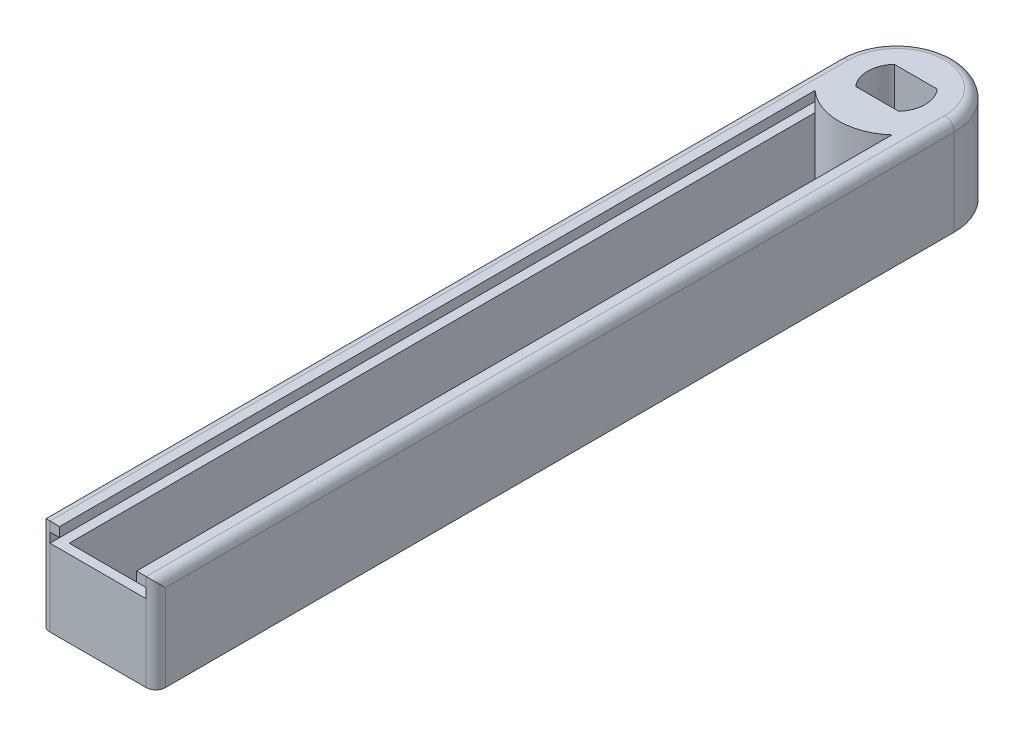
from build123d import *
from build123d.topology import SkipClean

# Parameters (mm, degrees)
SKETCH1_W           = 1
SKETCH1_H           = 1
SKETCH1_W_2         = 5
BOSS_EXTRUDE2_DEPTH = 10
CUT_EXTRUDE1_DEPTH  = 7.5
CUT_EXTRUDE2_START  = -2.5
CUT_EXTRUDE2_DEPTH  = 2.5
CUT_EXTRUDE3_REACH  = 92.05
SKETCH5_W           = 5
SKETCH5_H           = 1
SKETCH6_W           = 2
SKETCH6_H           = 1
BOSS_EXTRUDE3_DEPTH = 79.5
FILLET1_R           = 1
SKETCH7_W           = 1
SKETCH7_H           = 1
CUT_EXTRUDE7_DEPTH  = 79
BOSS_EXTRUDE4_DEPTH = 3
SKETCH9_W           = 1
SKETCH9_H           = 1
CUT_EXTRUDE8_DEPTH  = 6
SKETCH11_W          = 1
SKETCH11_H          = 1
BOSS_EXTRUDE5_DEPTH = 80
SKETCH12_W          = 1
SKETCH12_H          = 1
BOSS_EXTRUDE6_DEPTH = 80
BOSS_EXTRUDE7_DEPTH = 8
CUT_EXTRUDE9_DEPTH  = 1
SKETCH15_R          = 3
CUT_EXTRUDE10_DEPTH = 2.5
CUT_EXTRUDE13_REACH = 79.281


with BuildPart() as part:
    # Sketch1 → Boss-Extrude2 (new body)
    with BuildSketch(Plane(origin=(0, 0, 0), x_dir=(1, 0, 0), z_dir=(0, 1, 0))):
        with BuildLine():
            Line((-5.881818182, 6.945454545), (-3.381818182, 6.945454545))
            Line((-3.381818182, 6.945454545), (-0.881818182, 6.945454545))
            ThreePointArc((-0.881818182, 6.945454545), (-3.381818182, 9.445454545), (-5.881818182, 6.945454545))
        make_face()
        with BuildLine():
            Line((-0.881818182, 6.945454545), (-3.381818182, 6.945454545))
            Line((-3.381818182, 6.945454545), (-3.381818182, 4.445454545))
            ThreePointArc((-3.381818182, 4.445454545), (-1.614051229, 5.177687592), (-0.881818182, 6.945454545))
        make_face()
        with BuildLine():
            Line((-3.381818182, 4.445454545), (-3.381818182, 6.945454545))
            Line((-3.381818182, 6.945454545), (-5.881818182, 6.945454545))
            ThreePointArc((-5.881818182, 6.945454545), (-5.149585135, 5.177687592), (-3.381818182, 4.445454545))
        make_face()
        with BuildLine():
            ThreePointArc((-0.881818182, 6.945454545), (-1.614051229, 5.177687592), (-3.381818182, 4.445454545))
            Line((-3.381818182, 4.445454545), (-3.381818182, 0.945454545))
            ThreePointArc((-3.381818182, 0.945454545), (-0.544543851, 1.658690472), (1.618181818, 3.628829755))
            ThreePointArc((1.618181818, 3.628829755), (2.362744465, 5.213403738), (2.618181818, 6.945454545))
            Line((2.618181818, 6.945454545), (-0.881818182, 6.945454545))
        make_face()
        with BuildLine():
            Line((-3.381818182, 0.945454545), (-3.381818182, 4.445454545))
            ThreePointArc((-3.381818182, 4.445454545), (-5.149585135, 5.177687592), (-5.881818182, 6.945454545))
            Line((-5.881818182, 6.945454545), (-9.381818182, 6.945454545))
            ThreePointArc((-9.381818182, 6.945454545), (-9.126380828, 5.213403738), (-8.381818182, 3.628829755))
            ThreePointArc((-8.381818182, 3.628829755), (-6.219092513, 1.658690472), (-3.381818182, 0.945454545))
        make_face()
        with BuildLine():
            ThreePointArc((-5.881818182, 6.945454545), (-3.381818182, 9.445454545), (-0.881818182, 6.945454545))
            Line((-0.881818182, 6.945454545), (2.618181818, 6.945454545))
            ThreePointArc((2.618181818, 6.945454545), (-3.381818182, 12.945454545), (-9.381818182, 6.945454545))
            Line((-9.381818182, 6.945454545), (-5.881818182, 6.945454545))
        make_face()
        with BuildLine():
            Line((2.618181818, -75.054545455), (2.618181818, 6.945454545))
            ThreePointArc((2.618181818, 6.945454545), (2.362744465, 5.213403738), (1.618181818, 3.628829755))
            Line((1.618181818, 3.628829755), (1.618181818, -75.054545455))
            Line((1.618181818, -75.054545455), (2.618181818, -75.054545455))
        make_face()
        with BuildLine():
            ThreePointArc((-8.381818182, 3.628829755), (-9.126380828, 5.213403738), (-9.381818182, 6.945454545))
            Line((-9.381818182, 6.945454545), (-9.381818182, -75.054545455))
            Line((-9.381818182, -75.054545455), (-8.381818182, -75.054545455))
            Line((-8.381818182, -75.054545455), (-8.381818182, 3.628829755))
        make_face()
        with Locations((-8.881818182, -75.554545455)):
            Rectangle(SKETCH1_W, SKETCH1_H)
        with Locations((-5.881818182, -75.554545455)):
            Rectangle(SKETCH1_W_2, SKETCH1_H)
        with Locations((-0.881818182, -75.554545455)):
            Rectangle(SKETCH1_W_2, SKETCH1_H)
        with Locations((2.118181818, -75.554545455)):
            Rectangle(SKETCH1_W, SKETCH1_H)
    extrude(amount=BOSS_EXTRUDE2_DEPTH)

    # Sketch3 → Cut-Extrude1 (cut)
    with BuildSketch(Plane(origin=(0, 10, 0), x_dir=(1, 0, 0), z_dir=(0, 1, 0))):
        with BuildLine():
            Line((-1.381818182, 8.445454545), (-5.381818182, 8.445454545))
            ThreePointArc((-5.381818182, 8.445454545), (-5.753526425, 7.736023967), (-5.881818182, 6.945454559))
            ThreePointArc((-5.881818182, 6.945454559), (-5.753526429, 6.154885137), (-5.381818182, 5.445454545))
            Line((-5.381818182, 5.445454545), (-1.381818182, 5.445454545))
            ThreePointArc((-1.381818182, 5.445454545), (-1.010109937, 6.15488513), (-0.881818182, 6.945454545))
            ThreePointArc((-0.881818182, 6.945454545), (-1.010109937, 7.73602396), (-1.381818182, 8.445454545))
        make_face()
    extrude(amount=-CUT_EXTRUDE1_DEPTH, mode=Mode.SUBTRACT)

    # Sketch4 → Cut-Extrude2 (cut)
    with SkipClean():  # the faces are left unmerged after this step: merging them gives an invalid solid
        with BuildSketch(Plane.XZ.offset(CUT_EXTRUDE2_START)):
            with BuildLine():
                ThreePointArc((-0.881818182, -6.945454545), (-1.614051229, -5.177687592), (-3.381818182, -4.445454545))
                Line((-3.381818182, -4.445454545), (-3.381818182, -9.445454545))
                ThreePointArc((-3.381818182, -9.445454545), (-1.614051229, -8.713221498), (-0.881818182, -6.945454545))
            make_face()
            with BuildLine():
                Line((-3.381818182, -9.445454545), (-3.381818182, -4.445454545))
                ThreePointArc((-3.381818182, -4.445454545), (-5.881818182, -6.945454545), (-3.381818182, -9.445454545))
            make_face()
        extrude(amount=CUT_EXTRUDE2_DEPTH, mode=Mode.SUBTRACT)

    # Sketch5 → Cut-Extrude3 (cut, up to next)
    with BuildSketch(Plane.XY.offset(76.054545455), mode=Mode.PRIVATE) as cut_extrude3_sk1:
        with Locations((-5.881818182, 8.5)):
            Rectangle(SKETCH5_W, SKETCH5_H)
    cut_extrude3_tool1 = extrude(cut_extrude3_sk1.sketch, amount=-CUT_EXTRUDE3_REACH, mode=Mode.PRIVATE) & part.part
    # Sketch5 → Cut-Extrude3 (cut, up to next)
    with BuildSketch(Plane.XY.offset(76.054545455), mode=Mode.PRIVATE) as cut_extrude3_sk2:
        with Locations((-0.881818182, 8.5)):
            Rectangle(SKETCH5_W, SKETCH5_H)
    cut_extrude3_tool2 = extrude(cut_extrude3_sk2.sketch, amount=-CUT_EXTRUDE3_REACH, mode=Mode.PRIVATE) & part.part
    add(cut_extrude3_tool1.solids().sort_by_distance((-5.881818, 8.5, 76.054545))[0], mode=Mode.SUBTRACT)
    add(cut_extrude3_tool2.solids().sort_by_distance((-0.881818, 8.5, 76.054545))[0], mode=Mode.SUBTRACT)

    # Sketch6 → Boss-Extrude3 (add)
    with SkipClean():  # the faces are left unmerged after this step: merging them gives an invalid solid
        with BuildSketch(Plane.XY.offset(76.054545455)):
            with Locations((-7.381818182, 9.5)):
                Rectangle(SKETCH6_W, SKETCH6_H)
            with Locations((-7.381818182, 7.5)):
                Rectangle(SKETCH6_W, SKETCH6_H)
            with Locations((0.618181818, 7.5)):
                Rectangle(SKETCH6_W, SKETCH6_H)
            with Locations((0.618181818, 9.5)):
                Rectangle(SKETCH6_W, SKETCH6_H)
        extrude(amount=-BOSS_EXTRUDE3_DEPTH)

    # Fillet1
    fillet1_edges = [part.edges().sort_by_distance(p)[0] for p in [
        (2.618181818, 10, 34.554545455),
        (-9.381818182, 5, 76.054545455),
        (2.618181818, 5, 76.054545455),
        (-3.381818182, 10, -12.945454545),
        (-9.381818182, 10, 34.554545455),
    ]]
    fillet(fillet1_edges, radius=FILLET1_R - 0.0001)  # a hair under: the kernel refuses the full size

    # Sketch7 → Cut-Extrude7 (cut)
    with BuildSketch(Plane.XY.offset(76.054545455)):
        with Locations((-6.881818182, 9.5)):
            Rectangle(SKETCH7_W, SKETCH7_H)
        with Locations((0.118181818, 9.5)):
            Rectangle(SKETCH7_W, SKETCH7_H)
    extrude(amount=-CUT_EXTRUDE7_DEPTH, mode=Mode.SUBTRACT)


with BuildPart() as cut_extrude7_piece_1:
    # of the separate pieces the step leaves, piece 1, a body of its own (cut_extrude7_pieces)
    add(part.part.solids().sort_by_distance((1.618281818, 0, 76.054545455))[0])

    # Sketch8 → Boss-Extrude4 (add)
    # profile 1 of 5: a face of its own
    with BuildSketch(Plane(origin=(0, 10, 0), x_dir=(1, 0, 0), z_dir=(0, 1, 0))):
        with BuildLine():
            Line((-8.381818182, 6.945454545), (-8.381818182, 3.628829755))
            ThreePointArc((-8.381818182, 3.628829755), (-8.319368136, 3.536554363), (-8.255215354, 3.445454545))
            ThreePointArc((-8.255215354, 3.445454545), (-7.845063237, 2.935536395), (-7.381818182, 2.47331859))
            Line((-7.381818182, 2.47331859), (-7.381818182, 2.945454545))
            Line((-7.381818182, 2.945454545), (-6.381818182, 2.945454545))
            Line((-6.381818182, 2.945454545), (-6.381818182, 1.749302123))
            ThreePointArc((-6.381818182, 1.749302123), (-3.381818182, 0.945454545), (-0.381818182, 1.749302123))
            Line((-0.381818182, 1.749302123), (-0.381818182, 2.945454545))
            Line((-0.381818182, 2.945454545), (0.618181818, 2.945454545))
            Line((0.618181818, 2.945454545), (0.618181818, 2.47331859))
            ThreePointArc((0.618181818, 2.47331859), (1.081426873, 2.935536395), (1.491578991, 3.445454545))
            ThreePointArc((1.491578991, 3.445454545), (1.555731772, 3.536554363), (1.618181818, 3.628829755))
            Line((1.618181818, 3.628829755), (1.618181818, 6.945454545))
            ThreePointArc((1.618181818, 6.945454545), (-3.381818182, 11.945454545), (-8.381818182, 6.945454545))
        make_face()
        with BuildLine():
            ThreePointArc((-5.381818182, 5.445454545), (-5.881818182, 6.945454545), (-5.381818182, 8.445454545))
            ThreePointArc((-5.381818182, 8.445454545), (-3.381818182, 9.445454545), (-1.381818182, 8.445454545))
            ThreePointArc((-1.381818182, 8.445454545), (-1.010109937, 7.73602396), (-0.881818182, 6.945454545))
            ThreePointArc((-0.881818182, 6.945454545), (-1.010109937, 6.15488513), (-1.381818182, 5.445454545))
            ThreePointArc((-1.381818182, 5.445454545), (-3.381818182, 4.445454545), (-5.381818182, 5.445454545))
        make_face(mode=Mode.SUBTRACT)
    # profile 2 of 5: a face of its own
    with BuildSketch(Plane(origin=(0, 10, 0), x_dir=(1, 0, 0), z_dir=(0, 1, 0))):
        with BuildLine():
            ThreePointArc((-0.381818182, 1.749302123), (0.136853437, 2.085521414), (0.618181818, 2.47331859))
            Line((0.618181818, 2.47331859), (0.618181818, 2.945454545))
            Line((0.618181818, 2.945454545), (-0.381818182, 2.945454545))
            Line((-0.381818182, 2.945454545), (-0.381818182, 1.749302123))
        make_face()
    # profile 3 of 5: a face of its own
    with BuildSketch(Plane(origin=(0, 10, 0), x_dir=(1, 0, 0), z_dir=(0, 1, 0))):
        with BuildLine():
            Line((-7.381818182, 2.945454545), (-7.381818182, 2.47331859))
            ThreePointArc((-7.381818182, 2.47331859), (-6.900489801, 2.085521414), (-6.381818182, 1.749302123))
            Line((-6.381818182, 1.749302123), (-6.381818182, 2.945454545))
            Line((-6.381818182, 2.945454545), (-7.381818182, 2.945454545))
        make_face()
    # profile 4 of 5: a face of its own
    with BuildSketch(Plane(origin=(0, 10, 0), x_dir=(1, 0, 0), z_dir=(0, 1, 0))):
        with BuildLine():
            ThreePointArc((-1.381818182, 8.445454545), (-3.381818182, 9.445454545), (-5.381818182, 8.445454545))
            Line((-5.381818182, 8.445454545), (-1.381818182, 8.445454545))
        make_face()
    # profile 5 of 5: a face of its own
    with BuildSketch(Plane(origin=(0, 10, 0), x_dir=(1, 0, 0), z_dir=(0, 1, 0))):
        with BuildLine():
            Line((-1.381818182, 5.445454545), (-5.381818182, 5.445454545))
            ThreePointArc((-5.381818182, 5.445454545), (-3.381818182, 4.445454545), (-1.381818182, 5.445454545))
        make_face()
    extrude(amount=-BOSS_EXTRUDE4_DEPTH)

    # Sketch11 → Boss-Extrude5 (add)
    with BuildSketch(Plane.XY.offset(76.054545455)):
        with Locations((-7.881818182, 9.5)):
            Rectangle(SKETCH11_W, SKETCH11_H)
    extrude(amount=-BOSS_EXTRUDE5_DEPTH)

    # Sketch12 → Boss-Extrude6 (add)
    with BuildSketch(Plane.XY.offset(76.054545455)):
        with Locations((1.118181818, 9.5)):
            Rectangle(SKETCH12_W, SKETCH12_H)
    extrude(amount=-BOSS_EXTRUDE6_DEPTH)

    # Sketch13 → Boss-Extrude7 (add)
    with BuildSketch(Plane(origin=(0, 8, 0), x_dir=(1, 0, 0), z_dir=(0, 1, 0))):
        with BuildLine():
            Line((-8.381818182, 3.445454545), (-8.381818182, -76.054545455))
            Line((-8.381818182, -76.054545455), (-7.381818182, -76.054545455))
            Line((-7.381818182, -76.054545455), (-7.381818182, 2.47331859))
            ThreePointArc((-7.381818182, 2.47331859), (-7.845063237, 2.935536395), (-8.255215354, 3.445454545))
            Line((-8.255215354, 3.445454545), (-8.381818182, 3.445454545))
        make_face()
        with BuildLine():
            Line((0.618181818, 2.47331859), (0.618181818, -76.054545455))
            Line((0.618181818, -76.054545455), (1.618181818, -76.054545455))
            Line((1.618181818, -76.054545455), (1.618181818, 3.445454545))
            Line((1.618181818, 3.445454545), (1.491578991, 3.445454545))
            ThreePointArc((1.491578991, 3.445454545), (1.081426873, 2.935536395), (0.618181818, 2.47331859))
        make_face()
    extrude(amount=-BOSS_EXTRUDE7_DEPTH)

    # Sketch14 → Cut-Extrude9 (cut)
    with BuildSketch(Plane(origin=(0, 8, 0), x_dir=(1, 0, 0), z_dir=(0, 1, 0))):
        with BuildLine():
            ThreePointArc((0.618181818, 2.47331859), (0.136853437, 2.085521414), (-0.381818182, 1.749302123))
            Line((-0.381818182, 1.749302123), (-0.381818182, -75.054545455))
            Line((-0.381818182, -75.054545455), (0.618181818, -75.054545455))
            Line((0.618181818, -75.054545455), (0.618181818, 2.47331859))
        make_face()
        with BuildLine():
            ThreePointArc((-6.381818182, 1.749302123), (-6.900489801, 2.085521414), (-7.381818182, 2.47331859))
            Line((-7.381818182, 2.47331859), (-7.381818182, -75.054545455))
            Line((-7.381818182, -75.054545455), (-6.381818182, -75.054545455))
            Line((-6.381818182, -75.054545455), (-6.381818182, 1.749302123))
        make_face()
    extrude(amount=-CUT_EXTRUDE9_DEPTH, mode=Mode.SUBTRACT)

    # Sketch15 → Cut-Extrude10 (cut)
    with BuildSketch(Plane.XZ):
        with Locations(Location((-3.381818182, -6.945454545, 0), (0, 0, 270))):
            Circle(SKETCH15_R)
    extrude(amount=-CUT_EXTRUDE10_DEPTH, mode=Mode.SUBTRACT)

    # Sketch17 → Cut-Extrude13 (cut, up to next)
    with BuildSketch(Plane(origin=(0, 10, 0), x_dir=(1, 0, 0), z_dir=(0, 1, 0)), mode=Mode.PRIVATE) as cut_extrude13_sk1:
        with BuildLine():
            Line((-1.145750204, 8.945454545), (-5.617886159, 8.945454545))
            ThreePointArc((-5.617886159, 8.945454545), (-6.381818182, 6.945454545), (-5.617886159, 4.945454545))
            Line((-5.617886159, 4.945454545), (-1.145750204, 4.945454545))
            ThreePointArc((-1.145750204, 4.945454545), (-0.579301105, 5.874988276), (-0.381818182, 6.945454545))
            ThreePointArc((-0.381818182, 6.945454545), (-0.579301105, 8.015920815), (-1.145750204, 8.945454545))
        make_face()
        with BuildLine():
            ThreePointArc((-1.381818182, 8.445454545), (-0.881818182, 6.945454545), (-1.381818182, 5.445454545))
            Line((-1.381818182, 5.445454545), (-5.381818182, 5.445454545))
            ThreePointArc((-5.381818182, 5.445454545), (-5.881818182, 6.945454545), (-5.381818182, 8.445454545))
            Line((-5.381818182, 8.445454545), (-1.381818182, 8.445454545))
        make_face(mode=Mode.SUBTRACT)
    cut_extrude13_tool1 = extrude(cut_extrude13_sk1.sketch, amount=-CUT_EXTRUDE13_REACH, mode=Mode.PRIVATE) & cut_extrude7_piece_1.part
    add(cut_extrude13_tool1.solids().sort_by_distance((-3.381818, 10, -8.873344))[0], mode=Mode.SUBTRACT)


with BuildPart() as cut_extrude7_piece_2:
    # of the separate pieces the step leaves, piece 2, a body of its own (cut_extrude7_pieces)
    add(part.part.solids().sort_by_distance((-6.381818182, 10, 76.054545455))[0])

    # Sketch9 → Cut-Extrude8 (cut)
    with BuildSketch(Plane.ZY.offset(6.381818182)):
        with Locations((75.554545455, 9.5)):
            Rectangle(SKETCH9_W, SKETCH9_H)
    extrude(amount=-CUT_EXTRUDE8_DEPTH, mode=Mode.SUBTRACT)


solid = cut_extrude7_piece_1.part
